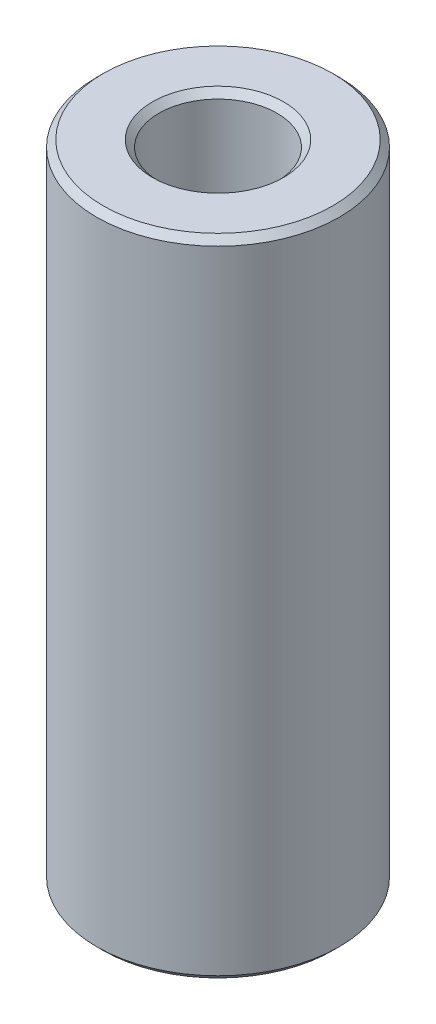
from build123d import *

# Parameters (mm, degrees)
SKETCH1_R           = 50
BOSS_EXTRUDE1_DEPTH = 265.873656697
SKETCH2_R           = 24.337491156
CUT_EXTRUDE1_DEPTH  = 276.115977954
CHAMFER1_SIZE       = 2.705438717


with BuildPart() as part:
    # Sketch1 → Boss-Extrude1 (new body)
    with BuildSketch(Plane(origin=(0, 0, 0), x_dir=(1, 0, 0), z_dir=(0, 1, 0))):
        Circle(SKETCH1_R)
    extrude(amount=BOSS_EXTRUDE1_DEPTH)

    # Sketch2 → Cut-Extrude1 (cut, through all)
    with BuildSketch(Plane(origin=(0, 0, 0), x_dir=(1, 0, 0), z_dir=(0, 1, 0))):
        Circle(SKETCH2_R)
    extrude(amount=CUT_EXTRUDE1_DEPTH, mode=Mode.SUBTRACT)

    # Chamfer1
    chamfer1_edges = [part.edges().sort_by_distance(p)[0] for p in [
        (-24.337491156, 265.873656697, 0),
        (-24.337491156, 0, 0),
        (-50, 0, 0),
        (-50, 265.873656697, 0),
    ]]
    chamfer(chamfer1_edges, length=CHAMFER1_SIZE)


solid = part.part
